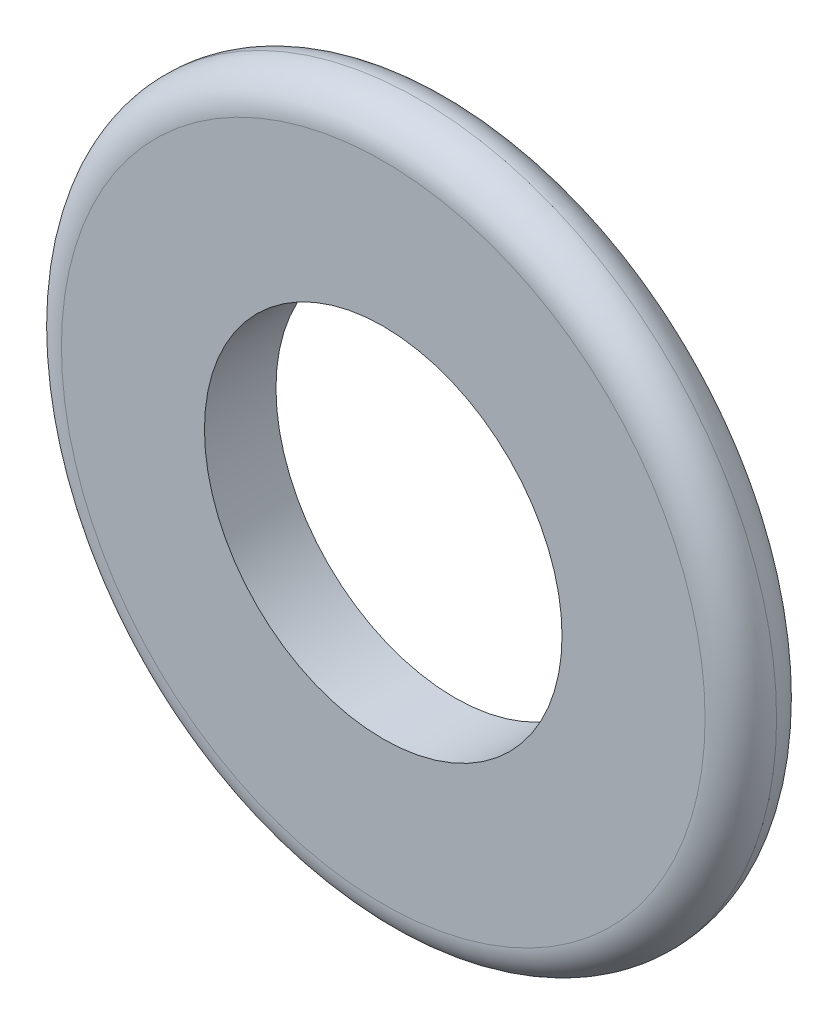
from build123d import *

# Parameters (mm, degrees)
SKETCH1_R           = 5
SKETCH1_R_2         = 2.5
BOSS_EXTRUDE1_DEPTH = 1
FILLET2_R           = 0.5


with BuildPart() as part:
    # Sketch1 → Boss-Extrude1 (new body)
    with BuildSketch(Plane.XY):
        Circle(SKETCH1_R)
        Circle(SKETCH1_R_2, mode=Mode.SUBTRACT)
    extrude(amount=BOSS_EXTRUDE1_DEPTH)

    # Fillet2
    fillet2_edges = [part.edges().sort_by_distance(p)[0] for p in [
        (-5, 0, 0),
        (-5, 0, 1),
    ]]
    fillet(fillet2_edges, radius=FILLET2_R - 0.0001)  # a hair under: the kernel refuses the full size


solid = part.part
